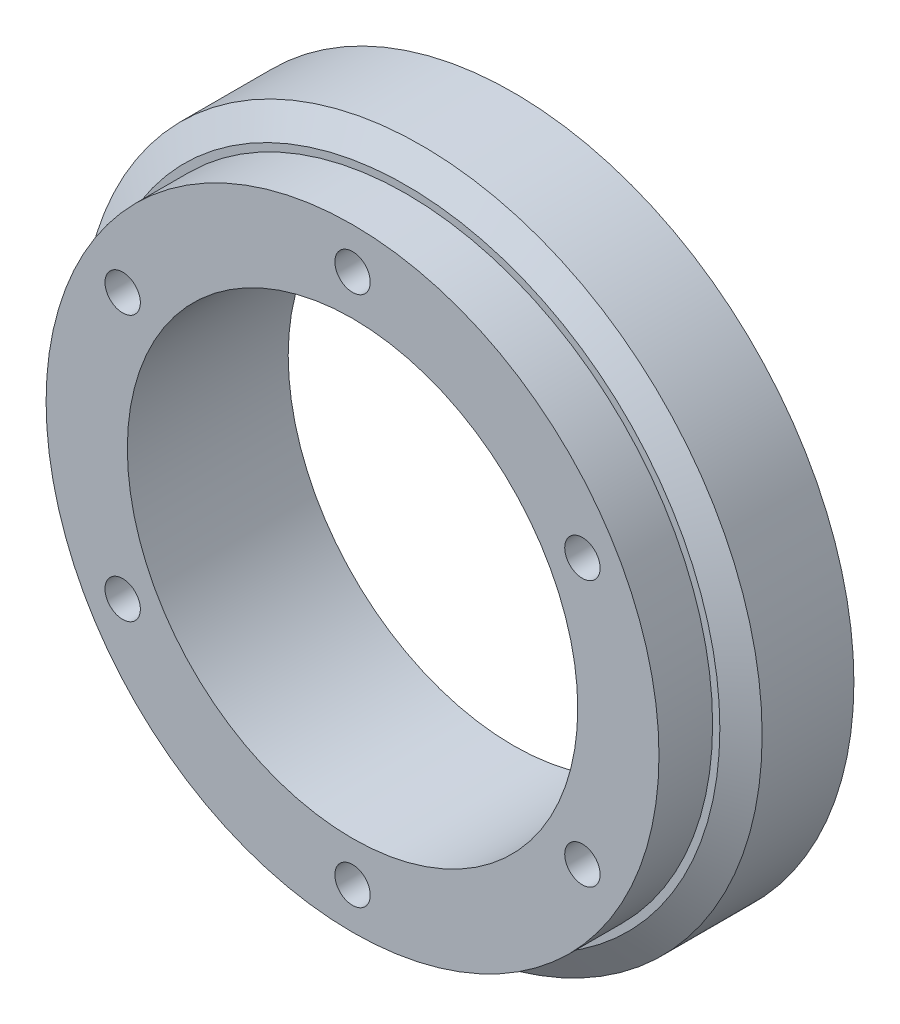
from build123d import *

# Parameters (mm, degrees)
M4X0_7_TAPPED_HOLE1_D = 3.3
CIRPATTERN1_COUNT     = 6


with BuildPart() as part:
    # Sketch1 → Revolve1 (revolve)
    with BuildSketch(Plane(origin=(0, 0, 0), x_dir=(0, 0, -1), z_dir=(1, 0, 0))):
        Polygon((0, 31.75), (-8.556624327, 31.75), (-10, 29.25), (-10, 28.575), (-15, 28.575), (-15, 21), (0, 21), align=None)
    revolve(axis=Axis((0, 0, 15), (0, 0, -1)))

    # M4x0.7 Tapped Hole1 (through all)
    with Locations(Plane(origin=(0, 0, 0), x_dir=(-1, 0, 0), z_dir=(0, 0, -1))):
        with Locations((0, 24.75)):
            m4x0_7_tapped_hole1 = Hole(M4X0_7_TAPPED_HOLE1_D / 2)

    # CirPattern1: M4x0.7 Tapped Hole1 ×6 about axis
    cirpattern1_axis = Axis((0, 0, 15), (0, 0, 1))
    for i in range(1, CIRPATTERN1_COUNT):
        add(m4x0_7_tapped_hole1.rotate(cirpattern1_axis, i * 360 / CIRPATTERN1_COUNT), mode=Mode.SUBTRACT)


solid = part.part
